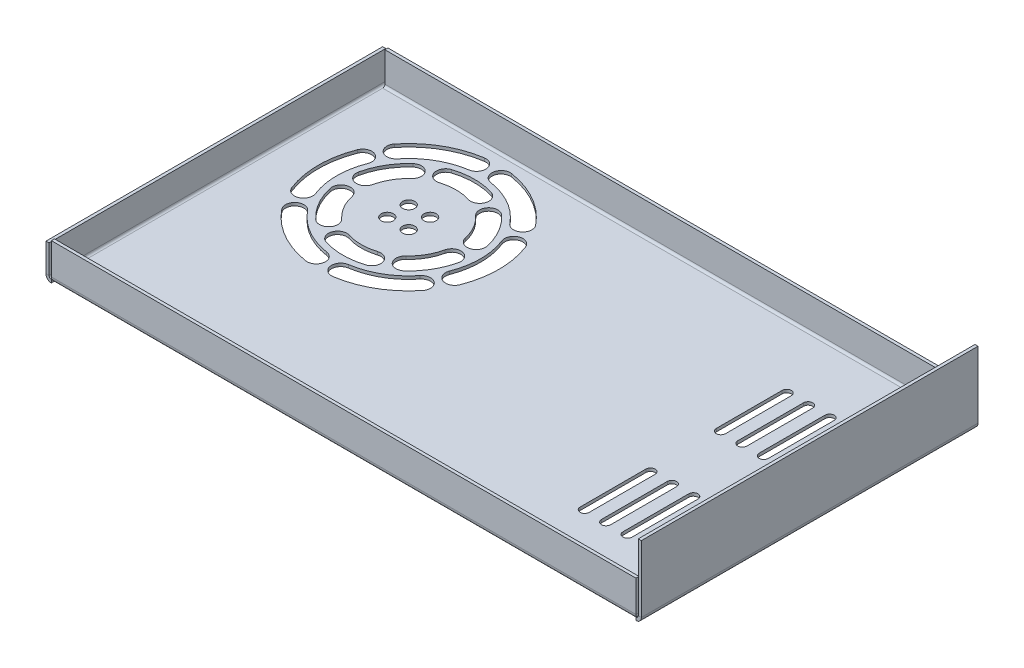
from build123d import *

# Parameters (mm, degrees)
SKETCH_1_W                       = 194.5
SKETCH_1_H                       = 110
SM_BASE_FLANGE_1_DEPTH           = 1
SM_EDGE_FLANGE_1_STRIP_W         = 5.4732
SM_EDGE_FLANGE_1_STRIP_H         = 1
SM_EDGE_FLANGE_1_STRIP_CUT_DEPTH = 110
SM_EDGE_FLANGE_1_DEPTH           = 110
SM_EDGE_FLANGE_2_STRIP_W         = 5.4732
SM_EDGE_FLANGE_2_STRIP_H         = 1
SM_EDGE_FLANGE_2_STRIP_CUT_DEPTH = 110
SM_EDGE_FLANGE_2_DEPTH           = 110
SM_EDGE_FLANGE_3_STRIP_W         = 5.4732
SM_EDGE_FLANGE_3_STRIP_H         = 1
SM_EDGE_FLANGE_3_STRIP_CUT_DEPTH = 191.0268
SM_EDGE_FLANGE_3_DEPTH           = 191.0268
SM_EDGE_FLANGE_4_STRIP_W         = 5.4732
SM_EDGE_FLANGE_4_STRIP_H         = 1
SM_EDGE_FLANGE_4_STRIP_CUT_DEPTH = 191.0268
SM_EDGE_FLANGE_4_DEPTH           = 191.0268
SKETCH_18_R                      = 2
CUT_EXTRUDE_1_DEPTH              = 115.170103355


# Sheet-metal steps are written as plain solids
with BuildPart() as part:
    # Sketch 1 → Базовая кромка1 (new body)
    with BuildSketch(Plane(origin=(0, 0, 0), x_dir=(1, 0, 0), z_dir=(0, 1, 0))):
        Rectangle(SKETCH_1_W, SKETCH_1_H)
    extrude(amount=-SM_BASE_FLANGE_1_DEPTH)

    # Ребро-кромка1 strip (across the edge) → Ребро-кромка1 strip cut (cut)
    with BuildSketch(Plane(origin=(97.25, 0, 55), x_dir=(-1, 0, 0), z_dir=(0, 0, -1))):
        with Locations((-1, -0.5)):
            Rectangle(SM_EDGE_FLANGE_1_STRIP_W, SM_EDGE_FLANGE_1_STRIP_H)
    extrude(amount=SM_EDGE_FLANGE_1_STRIP_CUT_DEPTH, mode=Mode.SUBTRACT)

    # Ребро-кромка1 section (across the edge) → Ребро-кромка1 (add)
    with BuildSketch(Plane(origin=(97.25, 0, 55), x_dir=(-1, 0, 0), z_dir=(0, 0, -1))):
        with BuildLine():
            Line((0, 0.7366), (0, 22.5))
            Line((0, 22.5), (1, 22.5))
            Line((1, 22.5), (1, 0.7366))
            ThreePointArc((1, 0.7366), (1.215745145, 0.215745145), (1.7366, 0))
            Line((1.7366, 0), (1.7366, -1))
            ThreePointArc((1.7366, -1), (0.508638364, -0.491361636), (0, 0.7366))
        make_face()
    extrude(amount=SM_EDGE_FLANGE_1_DEPTH)

    # Ребро-кромка2 strip (across the edge) → Ребро-кромка2 strip cut (cut)
    with BuildSketch(Plane(origin=(-97.25, 0, -55), x_dir=(1, 0, 0), z_dir=(0, 0, 1))):
        with Locations((-1, -0.5)):
            Rectangle(SM_EDGE_FLANGE_2_STRIP_W, SM_EDGE_FLANGE_2_STRIP_H)
    extrude(amount=SM_EDGE_FLANGE_2_STRIP_CUT_DEPTH, mode=Mode.SUBTRACT)

    # Ребро-кромка2 section (across the edge) → Ребро-кромка2 (add)
    with BuildSketch(Plane(origin=(-97.25, 0, -55), x_dir=(1, 0, 0), z_dir=(0, 0, 1))):
        with BuildLine():
            Line((0, 0.7366), (0, 10))
            Line((0, 10), (1, 10))
            Line((1, 10), (1, 0.7366))
            ThreePointArc((1, 0.7366), (1.215745145, 0.215745145), (1.7366, 0))
            Line((1.7366, 0), (1.7366, -1))
            ThreePointArc((1.7366, -1), (0.508638364, -0.491361636), (0, 0.7366))
        make_face()
    extrude(amount=SM_EDGE_FLANGE_2_DEPTH)

    # Ребро-кромка3 strip (across the edge) → Ребро-кромка3 strip cut (cut)
    with BuildSketch(Plane(origin=(-95.5134, 0, 55), x_dir=(0, 0, -1), z_dir=(1, 0, 0))):
        with Locations((-1, -0.5)):
            Rectangle(SM_EDGE_FLANGE_3_STRIP_W, SM_EDGE_FLANGE_3_STRIP_H)
    extrude(amount=SM_EDGE_FLANGE_3_STRIP_CUT_DEPTH, mode=Mode.SUBTRACT)

    # Ребро-кромка3 section (across the edge) → Ребро-кромка3 (add)
    with BuildSketch(Plane(origin=(-95.5134, 0, 55), x_dir=(0, 0, -1), z_dir=(1, 0, 0))):
        with BuildLine():
            Line((0, 0.7366), (0, 11))
            Line((0, 11), (1, 11))
            Line((1, 11), (1, 0.7366))
            ThreePointArc((1, 0.7366), (1.215745145, 0.215745145), (1.7366, 0))
            Line((1.7366, 0), (1.7366, -1))
            ThreePointArc((1.7366, -1), (0.508638364, -0.491361636), (0, 0.7366))
        make_face()
    extrude(amount=SM_EDGE_FLANGE_3_DEPTH)

    # Ребро-кромка4 strip (across the edge) → Ребро-кромка4 strip cut (cut)
    with BuildSketch(Plane(origin=(95.5134, 0, -55), x_dir=(0, 0, 1), z_dir=(-1, 0, 0))):
        with Locations((-1, -0.5)):
            Rectangle(SM_EDGE_FLANGE_4_STRIP_W, SM_EDGE_FLANGE_4_STRIP_H)
    extrude(amount=SM_EDGE_FLANGE_4_STRIP_CUT_DEPTH, mode=Mode.SUBTRACT)

    # Ребро-кромка4 section (across the edge) → Ребро-кромка4 (add)
    with BuildSketch(Plane(origin=(95.5134, 0, -55), x_dir=(0, 0, 1), z_dir=(-1, 0, 0))):
        with BuildLine():
            Line((0, 0.7366), (0, 10.5))
            Line((0, 10.5), (1, 10.5))
            Line((1, 10.5), (1, 0.7366))
            ThreePointArc((1, 0.7366), (1.215745145, 0.215745145), (1.7366, 0))
            Line((1.7366, 0), (1.7366, -1))
            ThreePointArc((1.7366, -1), (0.508638364, -0.491361636), (0, 0.7366))
        make_face()
    extrude(amount=SM_EDGE_FLANGE_4_DEPTH)

    # Эскиз18 → Вырез-Вытянуть1 (cut, through all)
    with BuildSketch(Plane.XZ.offset(1)):
        with Locations(Location((-58.25, -17.5, 0), (0, 0, 270))):
            Circle(SKETCH_18_R)
        with Locations(Location((-51.25, -17.5, 0), (0, 0, 270))):
            Circle(SKETCH_18_R)
        with Locations(Location((-51.25, -24.5, 0), (0, 0, 270))):
            Circle(SKETCH_18_R)
        with Locations(Location((-58.25, -24.5, 0), (0, 0, 270))):
            Circle(SKETCH_18_R)
        with BuildLine():
            Line((86.25, 33), (86.25, 11.5))
            ThreePointArc((86.25, 11.5), (84.75, 10), (83.25, 11.5))
            Line((83.25, 11.5), (83.25, 33))
            ThreePointArc((83.25, 33), (84.75, 34.5), (86.25, 33))
        make_face()
        with BuildLine():
            Line((86.25, -33), (86.25, -11.5))
            ThreePointArc((86.25, -11.5), (84.75, -10), (83.25, -11.5))
            Line((83.25, -11.5), (83.25, -33))
            ThreePointArc((83.25, -33), (84.75, -34.5), (86.25, -33))
        make_face()
        with BuildLine():
            Line((79.25, 33), (79.25, 11.5))
            ThreePointArc((79.25, 11.5), (77.75, 10), (76.25, 11.5))
            Line((76.25, 11.5), (76.25, 33))
            ThreePointArc((76.25, 33), (77.75, 34.5), (79.25, 33))
        make_face()
        with BuildLine():
            Line((79.25, -33), (79.25, -11.5))
            ThreePointArc((79.25, -11.5), (77.75, -10), (76.25, -11.5))
            Line((76.25, -11.5), (76.25, -33))
            ThreePointArc((76.25, -33), (77.75, -34.5), (79.25, -33))
        make_face()
        with BuildLine():
            Line((72.25, 33), (72.25, 11.5))
            ThreePointArc((72.25, 11.5), (70.75, 10), (69.25, 11.5))
            Line((69.25, 11.5), (69.25, 33))
            ThreePointArc((69.25, 33), (70.75, 34.5), (72.25, 33))
        make_face()
        with BuildLine():
            Line((72.25, -33), (72.25, -11.5))
            ThreePointArc((72.25, -11.5), (70.75, -10), (69.25, -11.5))
            Line((69.25, -11.5), (69.25, -33))
            ThreePointArc((69.25, -33), (70.75, -34.5), (72.25, -33))
        make_face()
        with BuildLine():
            Line((65.25, 33), (65.25, 11.5))
            ThreePointArc((65.25, 11.5), (63.75, 10), (62.25, 11.5))
            Line((62.25, 11.5), (62.25, 33))
            ThreePointArc((62.25, 33), (63.75, 34.5), (65.25, 33))
        make_face()
        with BuildLine():
            Line((65.25, -33), (65.25, -11.5))
            ThreePointArc((65.25, -11.5), (63.75, -10), (62.25, -11.5))
            Line((62.25, -11.5), (62.25, -33))
            ThreePointArc((62.25, -33), (63.75, -34.5), (65.25, -33))
        make_face()
        with BuildLine():
            Line((58.25, 33), (58.25, 11.5))
            ThreePointArc((58.25, 11.5), (56.75, 10), (55.25, 11.5))
            Line((55.25, 11.5), (55.25, 33))
            ThreePointArc((55.25, 33), (56.75, 34.5), (58.25, 33))
        make_face()
        with BuildLine():
            Line((58.25, -33), (58.25, -11.5))
            ThreePointArc((58.25, -11.5), (56.75, -10), (55.25, -11.5))
            Line((55.25, -11.5), (55.25, -33))
            ThreePointArc((55.25, -33), (56.75, -34.5), (58.25, -33))
        make_face()
        with BuildLine():
            ThreePointArc((-82.2314488, -10.275263554), (-84.25, -21), (-82.2314488, -31.724736446))
            ThreePointArc((-82.2314488, -31.724736446), (-78.346074029, -33.428808889), (-76.642001587, -29.543434118))
            ThreePointArc((-76.642001587, -29.543434118), (-78.25, -21), (-76.642001587, -12.456565882))
            ThreePointArc((-76.642001587, -12.456565882), (-78.346074029, -8.571191111), (-82.2314488, -10.275263554))
        make_face()
        with BuildLine():
            ThreePointArc((-61.219866371, -41.503434569), (-54.75, -42.5), (-48.280133629, -41.503434569))
            ThreePointArc((-48.280133629, -41.503434569), (-46.321961323, -37.739718159), (-50.085677733, -35.781545852))
            ThreePointArc((-50.085677733, -35.781545852), (-54.75, -36.5), (-59.414322267, -35.781545852))
            ThreePointArc((-59.414322267, -35.781545852), (-63.178038677, -37.739718159), (-61.219866371, -41.503434569))
        make_face()
        with BuildLine():
            ThreePointArc((-59.202830189, 8.162001017), (-69.5, 4.547749412), (-77.778618611, -2.562735429))
            ThreePointArc((-77.778618611, -2.562735429), (-77.311701251, -6.779604906), (-73.094831775, -6.312687545))
            ThreePointArc((-73.094831775, -6.312687545), (-66.5, -0.648403011), (-58.297169811, 2.230746573))
            ThreePointArc((-58.297169811, 2.230746573), (-55.784372778, 5.649203984), (-59.202830189, 8.162001017))
        make_face()
        with BuildLine():
            ThreePointArc((-75.741428387, -25.648648649), (-73.369546181, -31.75), (-69.271562017, -36.854785921))
            ThreePointArc((-69.271562017, -36.854785921), (-65.033001839, -36.668754678), (-65.219033082, -32.430194501))
            ThreePointArc((-65.219033082, -32.430194501), (-68.173393759, -28.75), (-69.883355349, -24.351351351))
            ThreePointArc((-69.883355349, -24.351351351), (-73.461040517, -22.070963481), (-75.741428387, -25.648648649))
        make_face()
        with BuildLine():
            ThreePointArc((-31.721381389, -2.562735429), (-40, 4.547749412), (-50.297169811, 8.162001017))
            ThreePointArc((-50.297169811, 8.162001017), (-53.715627222, 5.649203984), (-51.202830189, 2.230746573))
            ThreePointArc((-51.202830189, 2.230746573), (-43, -0.648403011), (-36.405168225, -6.312687545))
            ThreePointArc((-36.405168225, -6.312687545), (-32.188298749, -6.779604906), (-31.721381389, -2.562735429))
        make_face()
        with BuildLine():
            ThreePointArc((-69.271562017, -5.145214079), (-73.369546181, -10.25), (-75.741428387, -16.351351351))
            ThreePointArc((-75.741428387, -16.351351351), (-73.461040517, -19.929036519), (-69.883355349, -17.648648649))
            ThreePointArc((-69.883355349, -17.648648649), (-68.173393759, -13.25), (-65.219033082, -9.569805499))
            ThreePointArc((-65.219033082, -9.569805499), (-65.033001839, -5.331245322), (-69.271562017, -5.145214079))
        make_face()
        with BuildLine():
            ThreePointArc((-27.2685512, -31.724736446), (-25.25, -21), (-27.2685512, -10.275263554))
            ThreePointArc((-27.2685512, -10.275263554), (-31.153925971, -8.571191111), (-32.857998413, -12.456565882))
            ThreePointArc((-32.857998413, -12.456565882), (-31.25, -21), (-32.857998413, -29.543434118))
            ThreePointArc((-32.857998413, -29.543434118), (-31.153925971, -33.428808889), (-27.2685512, -31.724736446))
        make_face()
        with BuildLine():
            ThreePointArc((-48.280133629, -0.496565431), (-54.75, 0.5), (-61.219866371, -0.496565431))
            ThreePointArc((-61.219866371, -0.496565431), (-63.178038677, -4.260281841), (-59.414322267, -6.218454148))
            ThreePointArc((-59.414322267, -6.218454148), (-54.75, -5.5), (-50.085677733, -6.218454148))
            ThreePointArc((-50.085677733, -6.218454148), (-46.321961323, -4.260281841), (-48.280133629, -0.496565431))
        make_face()
        with BuildLine():
            ThreePointArc((-50.297169811, -50.162001017), (-40, -46.547749412), (-31.721381389, -39.437264571))
            ThreePointArc((-31.721381389, -39.437264571), (-32.188298749, -35.220395094), (-36.405168225, -35.687312455))
            ThreePointArc((-36.405168225, -35.687312455), (-43, -41.351596989), (-51.202830189, -44.230746573))
            ThreePointArc((-51.202830189, -44.230746573), (-53.715627222, -47.649203984), (-50.297169811, -50.162001017))
        make_face()
        with BuildLine():
            ThreePointArc((-33.758571613, -16.351351351), (-36.130453819, -10.25), (-40.228437983, -5.145214079))
            ThreePointArc((-40.228437983, -5.145214079), (-44.466998161, -5.331245322), (-44.280966918, -9.569805499))
            ThreePointArc((-44.280966918, -9.569805499), (-41.326606241, -13.25), (-39.616644651, -17.648648649))
            ThreePointArc((-39.616644651, -17.648648649), (-36.038959483, -19.929036519), (-33.758571613, -16.351351351))
        make_face()
        with BuildLine():
            ThreePointArc((-77.778618612, -39.437264571), (-69.5, -46.547749412), (-59.202830189, -50.162001017))
            ThreePointArc((-59.202830189, -50.162001017), (-55.784372778, -47.649203984), (-58.297169811, -44.230746573))
            ThreePointArc((-58.297169811, -44.230746573), (-66.5, -41.351596989), (-73.094831775, -35.687312455))
            ThreePointArc((-73.094831775, -35.687312455), (-77.311701251, -35.220395094), (-77.778618612, -39.437264571))
        make_face()
        with BuildLine():
            ThreePointArc((-40.228437983, -36.854785921), (-36.130453819, -31.75), (-33.758571613, -25.648648649))
            ThreePointArc((-33.758571613, -25.648648649), (-36.038959483, -22.070963481), (-39.616644651, -24.351351351))
            ThreePointArc((-39.616644651, -24.351351351), (-41.326606241, -28.75), (-44.280966918, -32.430194501))
            ThreePointArc((-44.280966918, -32.430194501), (-44.466998161, -36.668754678), (-40.228437983, -36.854785921))
        make_face()
    extrude(amount=-CUT_EXTRUDE_1_DEPTH, mode=Mode.SUBTRACT)


solid = part.part
